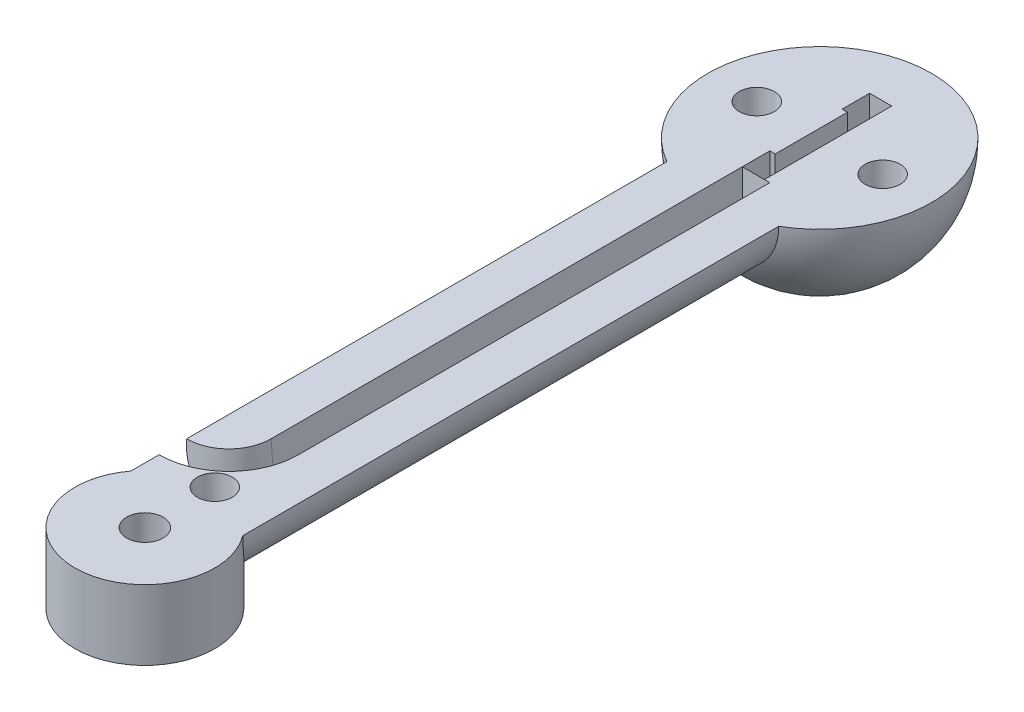
from build123d import *

# Parameters (mm, degrees)
SKETCH1_R                    = 10.16
BOSS_EXTRUDE1_DEPTH          = 101.6
SKETCH3_R                    = 12.7
SKETCH3_R_2                  = 3.302
BOSS_EXTRUDE2_DEPTH          = 12.7
SKETCH5_W                    = 50.328091527
SKETCH5_H                    = 177.713548071
CUT_EXTRUDE2_DEPTH           = 122.062113097
SKETCH4_W                    = 0.976
SKETCH4_H                    = 5
CUT_EXTRUDE3_DEPTH           = 11.684
CUT_EXTRUDE4_DEPTH           = 6.35
CUT_EXTRUDE4_DRAFT           = -5
SKETCH4_3_R                  = 3.175
CUT_EXTRUDE4_PROFILE_2_DEPTH = 6.35
CUT_EXTRUDE4_PROFILE_2_DRAFT = -5
CUT_EXTRUDE4_PROFILE_3_DEPTH = 6.35
CUT_EXTRUDE4_PROFILE_3_DRAFT = -5
CUT_EXTRUDE4_PROFILE_4_DEPTH = 6.35
CUT_EXTRUDE4_PROFILE_4_DRAFT = -5
CUT_EXTRUDE5_DEPTH           = 124.013791019


with BuildPart() as part:
    # Sketch1 → Boss-Extrude1 (new body)
    with BuildSketch(Plane.XY):
        Circle(SKETCH1_R)
    extrude(amount=BOSS_EXTRUDE1_DEPTH)

    # Sketch2 → Revolve1 (revolve)
    with BuildSketch(Plane(origin=(0, 0, 0), x_dir=(0, 0, -1), z_dir=(1, 0, 0))):
        with BuildLine():
            ThreePointArc((37.917636205, 0), (17.597636205, 20.32), (-2.722363795, 0))
            Line((-2.722363795, 0), (37.917636205, 0))
        make_face()
    revolve(axis=Axis((0, 0, 2.722363795), (0, 0, -1)))

    # Sketch3 → Boss-Extrude2 (add, symmetric)
    with BuildSketch(Plane(origin=(0, 0, 0), x_dir=(1, 0, 0), z_dir=(0, 1, 0))):
        with Locations((0, -104.902)):
            Circle(SKETCH3_R)
        with Locations((0, -104.902)):
            Circle(SKETCH3_R_2, mode=Mode.SUBTRACT)
    extrude(amount=BOSS_EXTRUDE2_DEPTH, both=True)

    # Sketch5 → Cut-Extrude2 (cut, through all)
    with BuildSketch(Plane(origin=(0, 0, 0), x_dir=(1, 0, 0), z_dir=(0, 1, 0))):
        with Locations((0.842814929, -41.287007492)):
            Rectangle(SKETCH5_W, SKETCH5_H)
    extrude(amount=CUT_EXTRUDE2_DEPTH, mode=Mode.SUBTRACT)

    # Sketch4 → Cut-Extrude3 (cut)
    with BuildSketch(Plane(origin=(0, 0, 0), x_dir=(1, 0, 0), z_dir=(0, 1, 0))):
        Polygon((-1.524, 11.040636205), (-1.524, 6.040636205), (1.524, 6.040636205), (1.524, 29.154636205), (-1.524, 29.154636205), (-1.524, 24.154636205), align=None)
        with Locations((-2.012, 8.540636205)):
            Rectangle(SKETCH4_W, SKETCH4_H)
        with Locations((-2.012, 26.654636205)):
            Rectangle(SKETCH4_W, SKETCH4_H)
    extrude(amount=-CUT_EXTRUDE3_DEPTH, mode=Mode.SUBTRACT)


with BuildPart() as cut_extrude4_tool:
    # Sketch4<3> → Cut-Extrude4 (with draft: the straight prism first)
    with BuildSketch(Plane(origin=(0, 0, 0), x_dir=(1, 0, 0), z_dir=(0, 1, 0))):
        with BuildLine():
            ThreePointArc((-2.5, -79.502), (-4.743562056, -84.918437944), (-10.16, -87.162))
            Line((-10.16, -87.162), (-10.16, -92.162))
            ThreePointArc((-10.16, -92.162), (-1.20802815, -88.45397185), (2.5, -79.502))
            Line((2.5, -79.502), (2.5, 6.040636205))
            Line((2.5, 6.040636205), (-2.5, 6.040636205))
            Line((-2.5, 6.040636205), (-2.5, -79.502))
        make_face()
    extrude(amount=-CUT_EXTRUDE4_DEPTH)
    # Cut-Extrude4: the draft: its side faces are tilted about the plane it starts from
    cut_extrude4_sides = [cut_extrude4_tool.faces().sort_by_distance(p)[0] for p in [
        (-4.743562056, -3.175, 84.918437944),
        (-10.16, -3.175, 89.662),
        (-1.20802815, -3.175, 88.45397185),
        (2.5, -3.175, 36.730681898),
        (0, -3.175, -6.040636205),
        (-2.5, -3.175, 36.730681898),
    ]]
    draft(cut_extrude4_sides, Plane(origin=(0, 0, 0), x_dir=(1, 0, 0), z_dir=(0, 1, 0)), CUT_EXTRUDE4_DRAFT)


with BuildPart() as part_1:
    add(part.part)

    # Cut-Extrude4: cut by cut_extrude4_tool
    add(cut_extrude4_tool.part, mode=Mode.SUBTRACT)


with BuildPart() as cut_extrude4_profile_2_tool:
    # Sketch4<3> → Cut-Extrude4 profile 2 (with draft: the straight prism first)
    with BuildSketch(Plane(origin=(0, 0, 0), x_dir=(1, 0, 0), z_dir=(0, 1, 0))):
        with Locations((-11.43, 17.597636205)):
            Circle(SKETCH4_3_R)
    extrude(amount=-CUT_EXTRUDE4_PROFILE_2_DEPTH)
    # Cut-Extrude4 profile 2: the draft: its side faces are tilted about the plane it starts from
    cut_extrude4_profile_2_sides = [cut_extrude4_profile_2_tool.faces().sort_by_distance(p)[0] for p in [
        (-14.605, -3.175, -17.597636205),
    ]]
    draft(cut_extrude4_profile_2_sides, Plane(origin=(0, 0, 0), x_dir=(1, 0, 0), z_dir=(0, 1, 0)), CUT_EXTRUDE4_PROFILE_2_DRAFT)


with BuildPart() as part_2:
    add(part_1.part)

    # Cut-Extrude4 profile 2: cut by cut_extrude4_profile_2_tool
    add(cut_extrude4_profile_2_tool.part, mode=Mode.SUBTRACT)


with BuildPart() as cut_extrude4_profile_3_tool:
    # Sketch4<3> → Cut-Extrude4 profile 3 (with draft: the straight prism first)
    with BuildSketch(Plane(origin=(0, 0, 0), x_dir=(1, 0, 0), z_dir=(0, 1, 0))):
        with Locations((11.43, 17.597636205)):
            Circle(SKETCH4_3_R)
    extrude(amount=-CUT_EXTRUDE4_PROFILE_3_DEPTH)
    # Cut-Extrude4 profile 3: the draft: its side faces are tilted about the plane it starts from
    cut_extrude4_profile_3_sides = [cut_extrude4_profile_3_tool.faces().sort_by_distance(p)[0] for p in [
        (8.255, -3.175, -17.597636205),
    ]]
    draft(cut_extrude4_profile_3_sides, Plane(origin=(0, 0, 0), x_dir=(1, 0, 0), z_dir=(0, 1, 0)), CUT_EXTRUDE4_PROFILE_3_DRAFT)


with BuildPart() as part_3:
    add(part_2.part)

    # Cut-Extrude4 profile 3: cut by cut_extrude4_profile_3_tool
    add(cut_extrude4_profile_3_tool.part, mode=Mode.SUBTRACT)


with BuildPart() as cut_extrude4_profile_4_tool:
    # Sketch4<3> → Cut-Extrude4 profile 4 (with draft: the straight prism first)
    with BuildSketch(Plane(origin=(0, 0, 0), x_dir=(1, 0, 0), z_dir=(0, 1, 0))):
        with Locations((0, -92.202)):
            Circle(SKETCH4_3_R)
    extrude(amount=-CUT_EXTRUDE4_PROFILE_4_DEPTH)
    # Cut-Extrude4 profile 4: the draft: its side faces are tilted about the plane it starts from
    cut_extrude4_profile_4_sides = [cut_extrude4_profile_4_tool.faces().sort_by_distance(p)[0] for p in [
        (-3.175, -3.175, 92.202),
    ]]
    draft(cut_extrude4_profile_4_sides, Plane(origin=(0, 0, 0), x_dir=(1, 0, 0), z_dir=(0, 1, 0)), CUT_EXTRUDE4_PROFILE_4_DRAFT)


with BuildPart() as part_4:
    add(part_3.part)

    # Cut-Extrude4 profile 4: cut by cut_extrude4_profile_4_tool
    add(cut_extrude4_profile_4_tool.part, mode=Mode.SUBTRACT)

    # Sketch7 → Cut-Extrude5 (cut, through all)
    with BuildSketch(Plane(origin=(-10.082823385, -0.882132743, 0), x_dir=(0, 0, -1), z_dir=(0.9961946980917457, 0.08715574274765837, 1.0368733976540235e-15))):
        Polygon((-92.006694168, -0.885502346), (-92.162, 0.885502346), (-87.162, 0.885502346), (-87.314828647, -0.885502346), align=None)
    extrude(amount=-CUT_EXTRUDE5_DEPTH, mode=Mode.SUBTRACT)


solid = part_4.part
